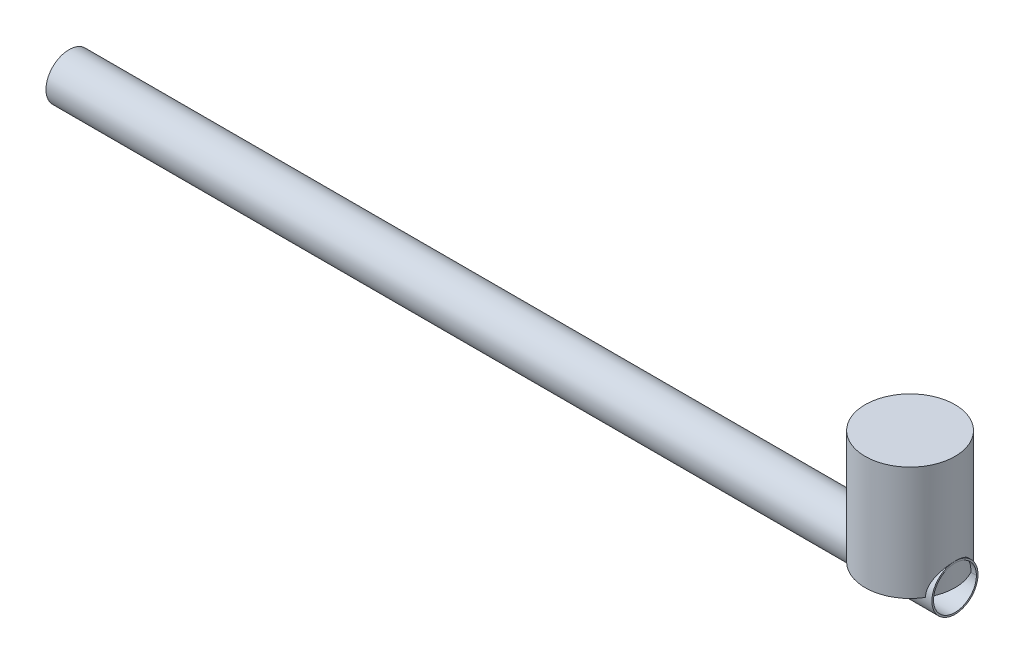
from build123d import *

# Parameters (mm, degrees)
SKETCH1_R           = 12.7
SKETCH1_R_2         = 11.811
BOSS_EXTRUDE1_DEPTH = 488.31
SKETCH2_R           = 24.73915762
BOSS_EXTRUDE2_DEPTH = 62.7


with BuildPart() as part:
    # Sketch1 → Boss-Extrude1 (new body)
    with BuildSketch(Plane(origin=(0, 0, 0), x_dir=(0, 0, -1), z_dir=(1, 0, 0))):
        Circle(SKETCH1_R)
        Circle(SKETCH1_R_2, mode=Mode.SUBTRACT)
    extrude(amount=BOSS_EXTRUDE1_DEPTH)

    # Sketch2 → Boss-Extrude2 (add)
    with BuildSketch(Plane(origin=(0, 0, 0), x_dir=(1, 0, 0), z_dir=(0, 1, 0))):
        with Locations((463.57084238, 0)):
            Circle(SKETCH2_R)
    extrude(amount=BOSS_EXTRUDE2_DEPTH)


solid = part.part
